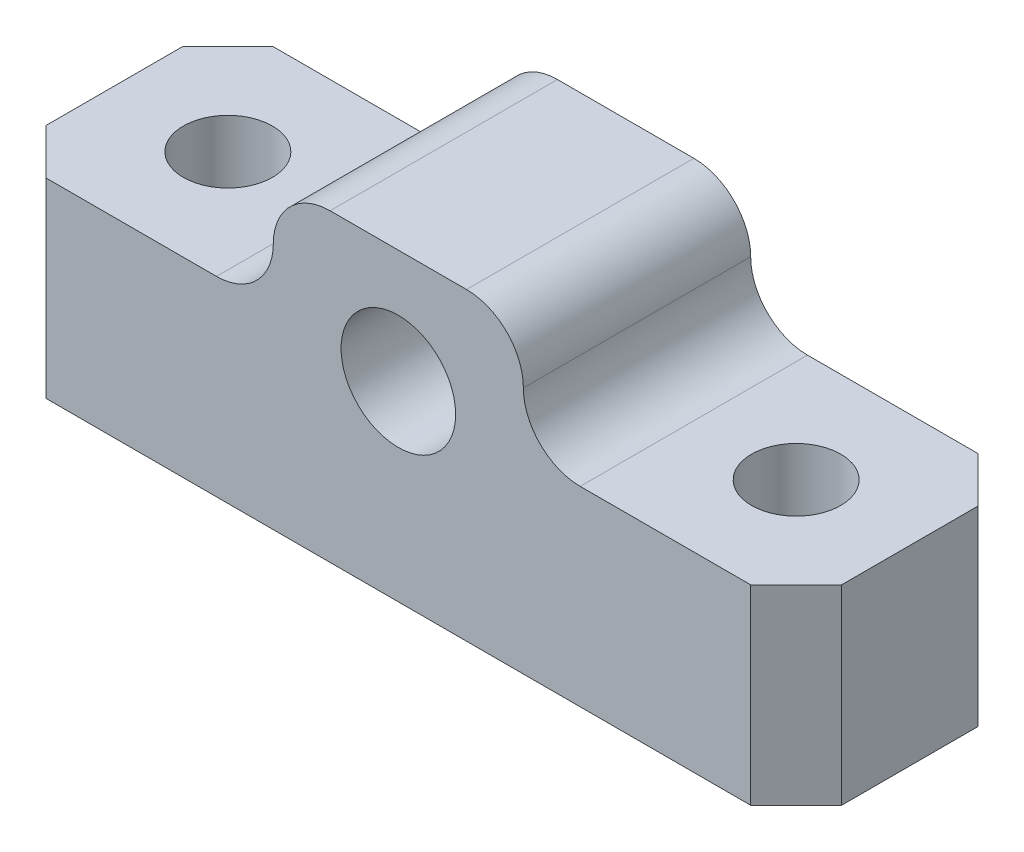
from build123d import *

# Parameters (mm, degrees)
BOSS_EXTRUDE1_DEPTH        = 12.7
CHAMFER1_SIZE              = 2.54
HOLE1_D                    = 4.9784
HOLE2_D                    = 4.9784
F_6_4_6_4_DIAMETER_HOLE1_D = 6.4
FILLET1_START              = -1
FILLET1_DEPTH              = 15
FILLET1_2_DEPTH            = 12.7


with BuildPart() as part:
    # Sketch1 → Boss-Extrude1 (new body)
    with BuildSketch(Plane(origin=(0, 0, 0), x_dir=(-1, 0, 0), z_dir=(0, 0, -1))):
        Polygon((-6.985, 10.668), (-22.225, 10.668), (-22.225, 0), (22.225, 0), (22.225, 10.668), (6.985, 10.668), (6.985, 17.018), (-6.985, 17.018), align=None)
    extrude(amount=-BOSS_EXTRUDE1_DEPTH)

    # Chamfer1
    chamfer1_edges = [part.edges().sort_by_distance(p)[0] for p in [
        (22.225, 5.334, 0),
        (22.225, 5.334, 12.7),
        (-22.225, 5.334, 12.7),
        (-22.225, 5.334, 0),
    ]]
    chamfer(chamfer1_edges, length=CHAMFER1_SIZE)

    # Hole1 (through all)
    with Locations(Plane(origin=(0, 10.668, 0), x_dir=(1, 0, 0), z_dir=(0, 1, 0))):
        with Locations((15.875, -6.35)):
            Hole(HOLE1_D / 2)

    # Hole2 (through all)
    with Locations(Plane(origin=(0, 10.668, 0), x_dir=(1, 0, 0), z_dir=(0, 1, 0))):
        with Locations((-15.875, -6.35)):
            Hole(HOLE2_D / 2)

    # Ø6.4 (6.4) Diameter Hole1 (through all)
    with Locations(Plane.XY.offset(12.7)):
        with Locations((0, 10.668)):
            Hole(F_6_4_6_4_DIAMETER_HOLE1_D / 2)

    # Fillet1: read off the stored shape, not the designer's step
    # Fillet1 outline → Fillet1 (cut)
    with BuildSketch(Plane.XY.offset(FILLET1_START)):
        with BuildLine():
            Line((-6.985, 17.018), (-6.985, 13.843))
            ThreePointArc((-6.985, 13.843), (-6.05506403, 16.08806403), (-3.81, 17.018))
            Line((-3.81, 17.018), (-6.985, 17.018))
        make_face()
        with BuildLine():
            Line((6.985, 17.018), (3.81, 17.018))
            ThreePointArc((3.81, 17.018), (6.05506403, 16.08806403), (6.985, 13.843))
            Line((6.985, 13.843), (6.985, 17.018))
        make_face()
    extrude(amount=FILLET1_DEPTH, mode=Mode.SUBTRACT)

    # Fillet1 2 outline → Fillet1 2 (add)
    with BuildSketch(Plane.XY):
        with BuildLine():
            Line((-6.985, 10.668), (-6.985, 13.843))
            ThreePointArc((-6.985, 13.843), (-7.91493597, 11.59793597), (-10.16, 10.668))
            Line((-10.16, 10.668), (-6.985, 10.668))
        make_face()
        with BuildLine():
            ThreePointArc((10.16, 10.668), (7.91493597, 11.59793597), (6.985, 13.843))
            Line((6.985, 13.843), (6.985, 10.668))
            Line((6.985, 10.668), (10.16, 10.668))
        make_face()
    extrude(amount=FILLET1_2_DEPTH)


solid = part.part
